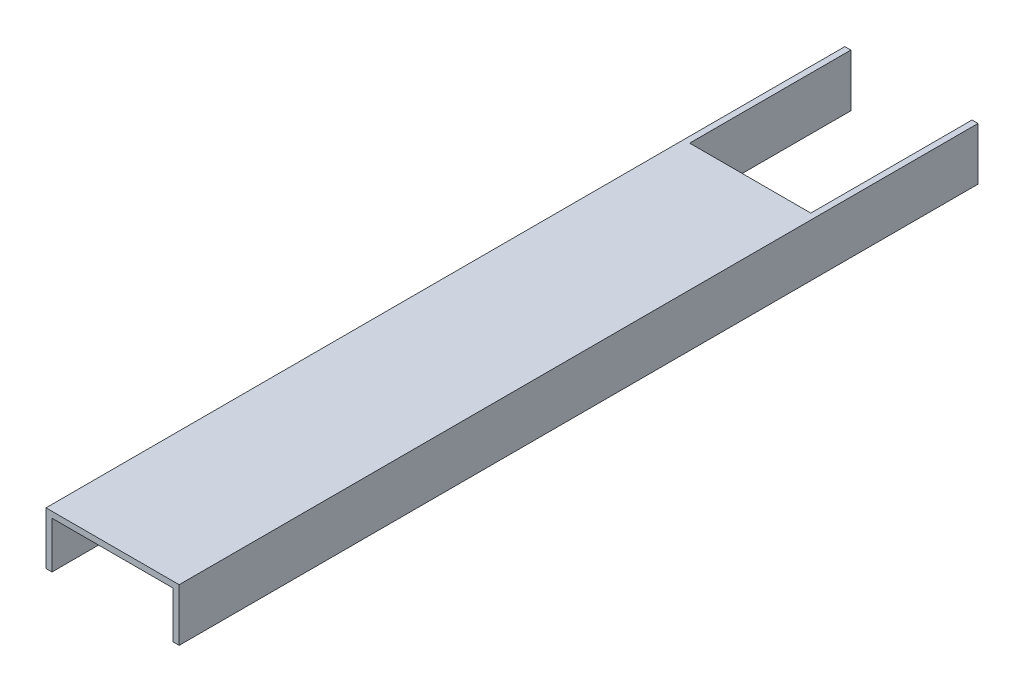
from build123d import *

# Parameters (mm, degrees)
BOSS_EXTRUDE1_DEPTH = 609.6
SKETCH3_W           = 92.456
SKETCH3_H           = 123.015502
CUT_EXTRUDE1_DEPTH  = 614.028039672


with BuildPart() as part:
    # Sketch1 → Boss-Extrude1 (new body)
    with BuildSketch(Plane.XY):
        Polygon((-50.8, 0), (50.8, 0), (50.8, -40.132), (46.228, -40.132), (46.228, -4.572), (-46.228, -4.572), (-46.228, -40.132), (-50.8, -40.132), align=None)
    extrude(amount=BOSS_EXTRUDE1_DEPTH)

    # Sketch3 → Cut-Extrude1 (cut, through all)
    with BuildSketch(Plane(origin=(0, 0, 0), x_dir=(1, 0, 0), z_dir=(0, 1, 0))):
        with Locations((0, -61.507751)):
            Rectangle(SKETCH3_W, SKETCH3_H)
    extrude(amount=-CUT_EXTRUDE1_DEPTH, mode=Mode.SUBTRACT)


solid = part.part
